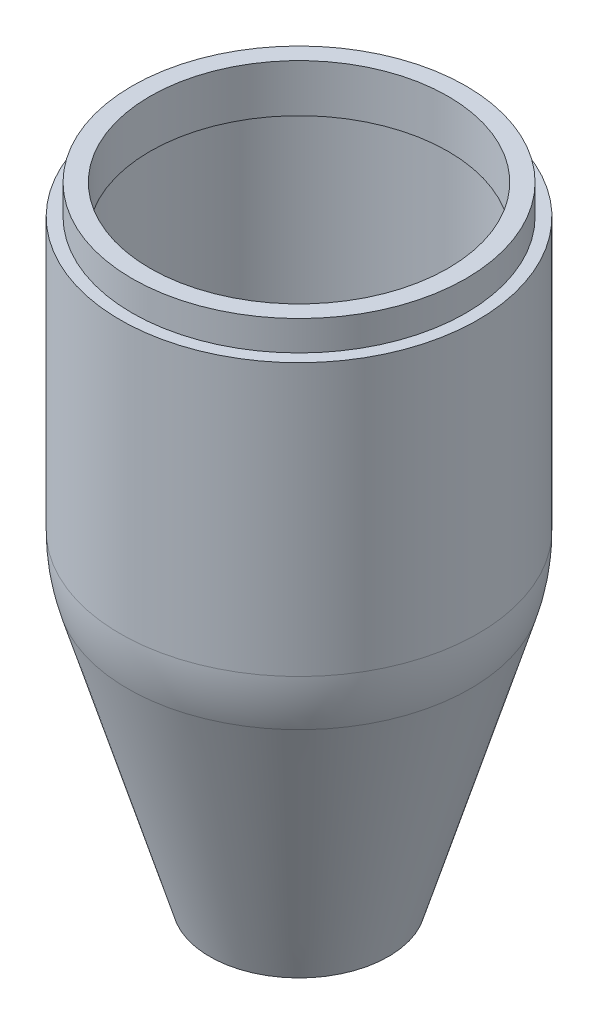
from build123d import *

# Parameters (mm, degrees)
SKETCH4_R           = 28
SKETCH4_R_2         = 25
EXTRUDE_THIN2_DEPTH = 5


# Read off the part's stored shape, not the designer's step: Shell1
with BuildPart() as part:
    # Sketch1 → Revolve1 (revolve)
    with BuildSketch(Plane.XY, mode=Mode.PRIVATE) as revolve1_sk:
        with BuildLine():
            Line((0, 0), (0, 100))
            Line((0, 100), (30, 100))
            Line((30, 100), (30, 54.403065089))
            ThreePointArc((30, 54.403065089), (29.682011865, 50.046670749), (28.734788557, 45.782628522))
            Line((28.734788557, 45.782628522), (15, 0))
            Line((15, 0), (0, 0))
        make_face()
    revolve(revolve1_sk.sketch.rotate(Axis((0, 0, 0), (0, 1, 0)), 90), axis=Axis((0, 0, 0), (0, 1, 0)))

    # Sketch4 → Extrude-Thin2 (add)
    with BuildSketch(Plane(origin=(0, 100, 0), x_dir=(1, 0, 0), z_dir=(0, 1, 0))):
        Circle(SKETCH4_R)
        Circle(SKETCH4_R_2, mode=Mode.SUBTRACT)
    extrude(amount=EXTRUDE_THIN2_DEPTH)

    # Shell1 outline → Shell1 (revolve, cut)
    with BuildSketch(Plane.XY):
        with BuildLine():
            Line((25, 97), (25, 100))
            Line((25, 100), (0, 100))
            Line((0, 100), (0, 3))
            Line((0, 3), (12.767908047, 3))
            Line((12.767908047, 3), (25.861309693, 46.644672153))
            ThreePointArc((25.861309693, 46.644672153), (26.713810678, 50.482310183), (27, 54.403065116))
            Line((27, 54.403065116), (27, 97))
            Line((27, 97), (25, 97))
        make_face()
    revolve(axis=Axis((0, 0, 0), (0, 1, 0)), mode=Mode.SUBTRACT)


solid = part.part
